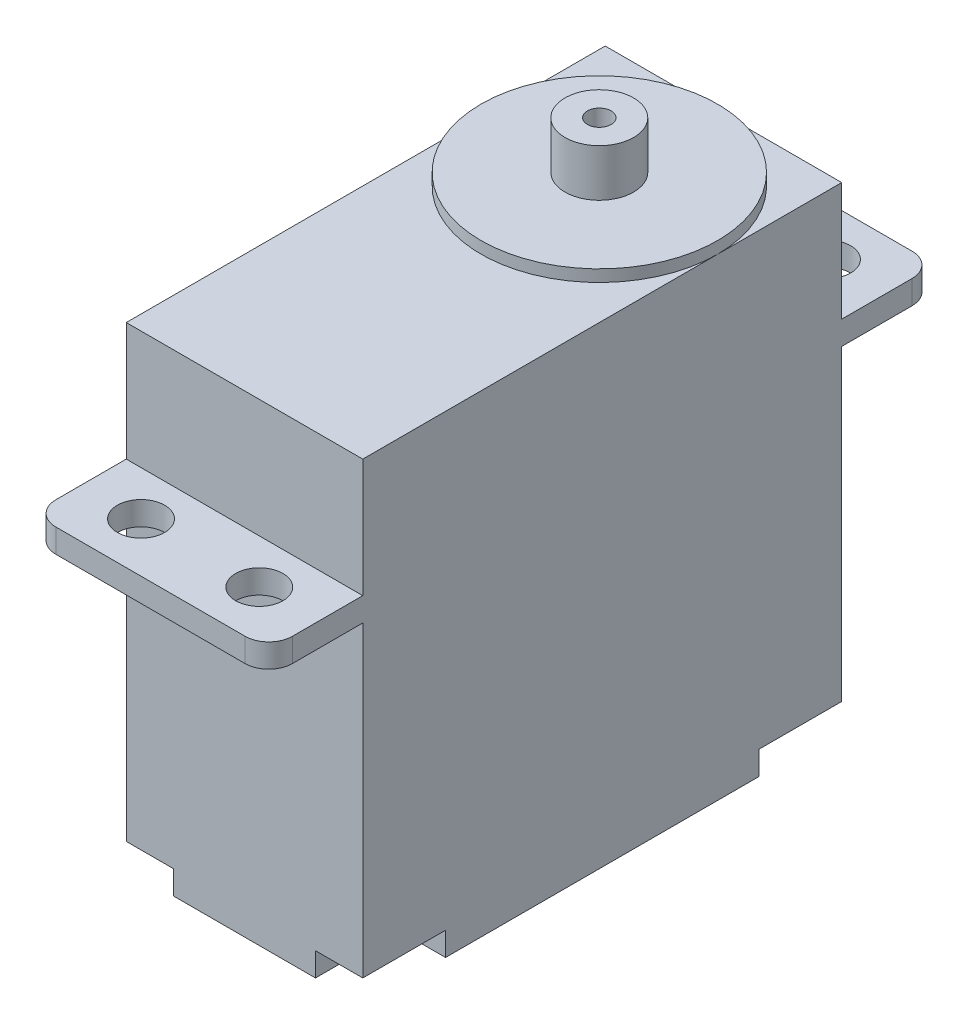
from build123d import *

# Parameters (mm, degrees)
SKETCH2_W           = 20
SKETCH2_H           = 40.5
BOSS_EXTRUDE1_DEPTH = 28
SKETCH3_W           = 20
SKETCH3_H           = 56.4
BOSS_EXTRUDE2_DEPTH = 2
SKETCH4_W           = 20
SKETCH4_H           = 40.5
BOSS_EXTRUDE3_DEPTH = 10
SKETCH5_R           = 10
BOSS_EXTRUDE4_DEPTH = 1
SKETCH6_R           = 2.9
SKETCH6_R_2         = 1
BOSS_EXTRUDE5_DEPTH = 4
SKETCH7_R           = 2
CUT_EXTRUDE1_DEPTH  = 2
FILLET1_R           = 2
SKETCH8_W           = 4
SKETCH8_H           = 7
CUT_EXTRUDE2_DEPTH  = 2
SKETCH9_W           = 8
SKETCH9_H           = 3
BOSS_EXTRUDE6_DEPTH = 5


with BuildPart() as part:
    # Sketch2 → Boss-Extrude1 (new body)
    with BuildSketch(Plane(origin=(0, 77, 0), x_dir=(1, 0, 0), z_dir=(0, 1, 0))):
        with Locations((-39.282617367, 276.14521975)):
            Rectangle(SKETCH2_W, SKETCH2_H)
    extrude(amount=BOSS_EXTRUDE1_DEPTH)

    # Sketch3 → Boss-Extrude2 (add)
    with BuildSketch(Plane(origin=(0, 105, 0), x_dir=(1, 0, 0), z_dir=(0, 1, 0))):
        with Locations((-39.282617367, 276.14521975)):
            Rectangle(SKETCH3_W, SKETCH3_H)
    extrude(amount=BOSS_EXTRUDE2_DEPTH)

    # Sketch4 → Boss-Extrude3 (add)
    with BuildSketch(Plane(origin=(0, 107, 0), x_dir=(1, 0, 0), z_dir=(0, 1, 0))):
        with Locations((-39.282617367, 276.14521975)):
            Rectangle(SKETCH4_W, SKETCH4_H)
    extrude(amount=BOSS_EXTRUDE3_DEPTH)

    # Sketch5 → Boss-Extrude4 (add)
    with BuildSketch(Plane(origin=(0, 117, 0), x_dir=(1, 0, 0), z_dir=(0, 1, 0))):
        with Locations((-39.282617367, 285.89521975)):
            Circle(SKETCH5_R)
    extrude(amount=BOSS_EXTRUDE4_DEPTH)

    # Sketch6 → Boss-Extrude5 (add)
    with BuildSketch(Plane(origin=(0, 118, 0), x_dir=(1, 0, 0), z_dir=(0, 1, 0))):
        with Locations((-39.282617367, 285.89521975)):
            Circle(SKETCH6_R)
        with Locations((-39.282617367, 285.89521975)):
            Circle(SKETCH6_R_2, mode=Mode.SUBTRACT)
    extrude(amount=BOSS_EXTRUDE5_DEPTH)

    # Sketch7 → Cut-Extrude1 (cut)
    with BuildSketch(Plane(origin=(0, 107, 0), x_dir=(1, 0, 0), z_dir=(0, 1, 0))):
        with Locations((-44.282617367, 252.14521975)):
            Circle(SKETCH7_R)
        with Locations((-34.282617367, 252.14521975)):
            Circle(SKETCH7_R)
        with Locations((-34.282617367, 300.14521975)):
            Circle(SKETCH7_R)
        with Locations((-44.282617367, 300.14521975)):
            Circle(SKETCH7_R)
    extrude(amount=-CUT_EXTRUDE1_DEPTH, mode=Mode.SUBTRACT)

    # Fillet1
    fillet1_edges = [part.edges().sort_by_distance(p)[0] for p in [
        (-29.282617367, 106, -304.34521975),
        (-49.282617367, 106, -304.34521975),
        (-49.282617367, 106, -247.94521975),
        (-29.282617367, 106, -247.94521975),
    ]]
    fillet(fillet1_edges, radius=FILLET1_R)

    # Sketch8 → Cut-Extrude2 (cut)
    with BuildSketch(Plane.XZ.offset(-77)):
        with Locations((-31.282617367, -259.39521975)):
            Rectangle(SKETCH8_W, SKETCH8_H)
        with Locations((-31.282617367, -292.89521975)):
            Rectangle(SKETCH8_W, SKETCH8_H)
        with Locations((-47.282617367, -292.89521975)):
            Rectangle(SKETCH8_W, SKETCH8_H)
        with Locations((-47.282617367, -259.39521975)):
            Rectangle(SKETCH8_W, SKETCH8_H)
    extrude(amount=-CUT_EXTRUDE2_DEPTH, mode=Mode.SUBTRACT)

    # Sketch9 → Boss-Extrude6 (add)
    with BuildSketch(Plane(origin=(0, 0, -296.39521975), x_dir=(-1, 0, 0), z_dir=(0, 0, -1))):
        with Locations((39.282617367, 78.5)):
            Rectangle(SKETCH9_W, SKETCH9_H)
    extrude(amount=BOSS_EXTRUDE6_DEPTH)


solid = part.part
